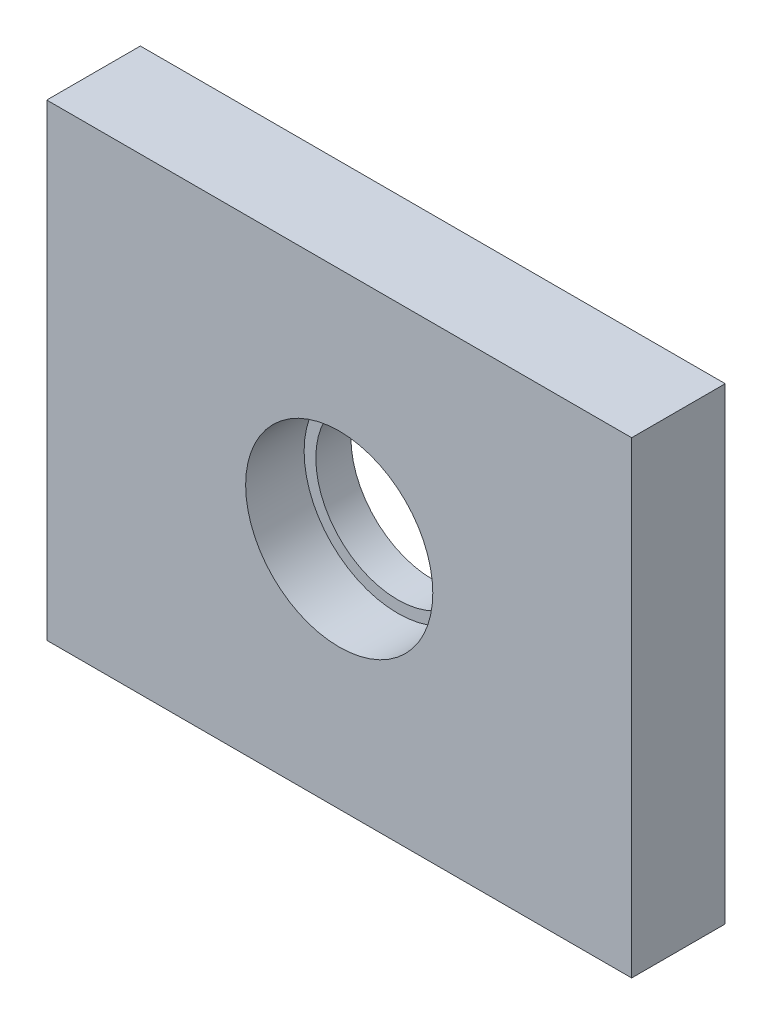
from build123d import *

# Parameters (mm, degrees)
ESQUISSE1_W             = 50
ESQUISSE1_H             = 40
ESQUISSE1_R             = 7
BOSS_EXTRU_1_DEPTH      = 8
ESQUISSE2_R             = 8
ENL_V_MAT_EXTRU_1_DEPTH = 5


with BuildPart() as part:
    # Esquisse1 → Boss.-Extru.1 (new body)
    with BuildSketch(Plane.XY):
        with Locations((25, 20)):
            Rectangle(ESQUISSE1_W, ESQUISSE1_H)
        with Locations((25, 20)):
            Circle(ESQUISSE1_R, mode=Mode.SUBTRACT)
    extrude(amount=BOSS_EXTRU_1_DEPTH)

    # Esquisse2 → Enlèv. mat.-Extru.1 (cut)
    with BuildSketch(Plane.XY.offset(8)):
        with Locations((25, 20)):
            Circle(ESQUISSE2_R)
    extrude(amount=-ENL_V_MAT_EXTRU_1_DEPTH, mode=Mode.SUBTRACT)


solid = part.part
